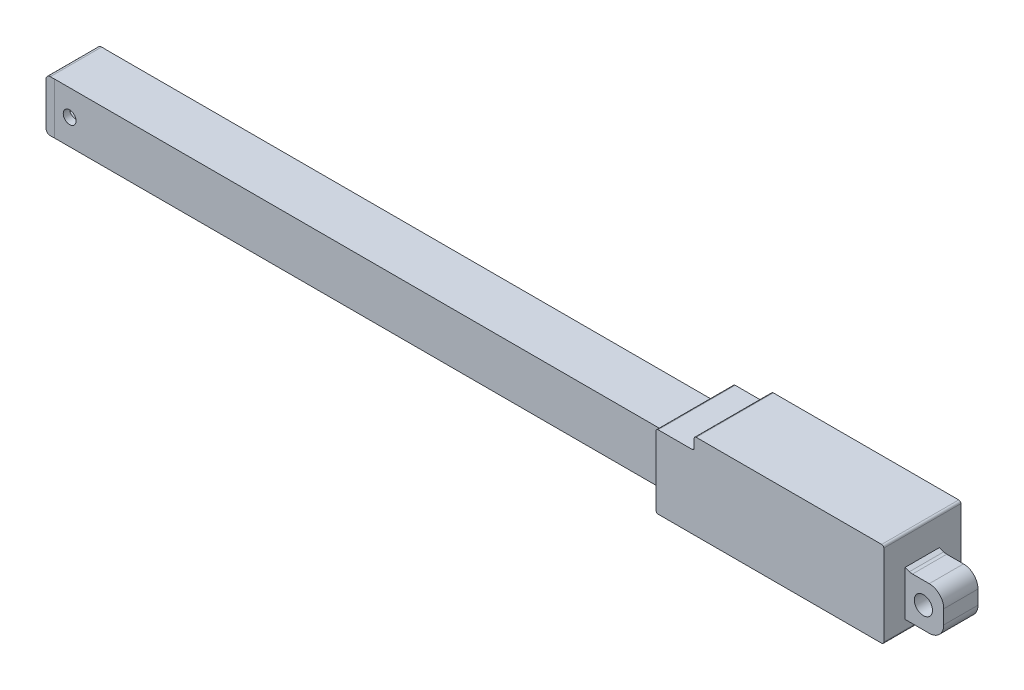
from build123d import *

# Parameters (mm, degrees)
SKETCH2_R           = 2.125
BOSS_EXTRUDE1_DEPTH = 9
SKETCH2_3_W         = 143.4775
SKETCH2_3_H         = 11.945
SKETCH2_3_R         = 1.5
BOSS_EXTRUDE2_DEPTH = 5.975
BOSS_EXTRUDE3_DEPTH = 6
SKETCH7_R           = 4.45
CUT_EXTRUDE4_DEPTH  = 138
CUT_EXTRUDE6_DEPTH  = 5
CUT_EXTRUDE7_DEPTH  = 5


with BuildPart() as part:
    # Sketch2 → Boss-Extrude1 (new, symmetric)
    with BuildSketch(Plane.XY):
        with BuildLine():
            Line((145.4775, 14.0125), (145.4775, 11.945))
            Line((145.4775, 11.945), (145.4775, 0))
            Line((145.4775, 0), (145.4775, -2.0675))
            ThreePointArc((145.4775, -2.0675), (145.623946609, -2.421053391), (145.9775, -2.5675))
            Line((145.9775, -2.5675), (198.1775, -2.5675))
            ThreePointArc((198.1775, -2.5675), (198.531053391, -2.421053391), (198.6775, -2.0675))
            Line((198.6775, -2.0675), (198.6775, 0))
            Line((198.6775, 0), (204.28834363, 0))
            ThreePointArc((204.28834363, 0), (206.684839082, 0.992660918), (207.6775, 3.38915637))
            Line((207.6775, 3.38915637), (207.6775, 6.65334363))
            ThreePointArc((207.6775, 6.65334363), (206.684839082, 9.049839082), (204.28834363, 10.0425))
            Line((204.28834363, 10.0425), (200.377364582, 10.0425))
            ThreePointArc((200.377364582, 10.0425), (200.021766481, 10.074366369), (199.6775, 10.168950009))
            Line((199.6775, 10.168950009), (198.6775, 10.5425))
            Line((198.6775, 10.5425), (198.6775, 16.9325))
            ThreePointArc((198.6775, 16.9325), (198.531053391, 17.286053391), (198.1775, 17.4325))
            Line((198.1775, 17.4325), (154.8775, 17.4325))
            ThreePointArc((154.8775, 17.4325), (154.523946609, 17.286053391), (154.3775, 16.9325))
            Line((154.3775, 16.9325), (154.3775, 15.0125))
            ThreePointArc((154.3775, 15.0125), (154.231053391, 14.658946609), (153.8775, 14.5125))
            Line((153.8775, 14.5125), (145.9775, 14.5125))
            ThreePointArc((145.9775, 14.5125), (145.623946609, 14.366053391), (145.4775, 14.0125))
        make_face()
        with Locations((202.9275, 5.02125)):
            Circle(SKETCH2_R, mode=Mode.SUBTRACT)
    extrude(amount=BOSS_EXTRUDE1_DEPTH, both=True)

    # Sketch2<3> → Boss-Extrude2 (add, symmetric)
    with BuildSketch(Plane.XY):
        with Locations((73.73875, 5.9725)):
            Rectangle(SKETCH2_3_W, SKETCH2_3_H)
        with Locations((5.5, 5.9725)):
            Circle(SKETCH2_3_R, mode=Mode.SUBTRACT)
    extrude(amount=BOSS_EXTRUDE2_DEPTH, both=True)

    # Sketch2<4> → Boss-Extrude3 (add, symmetric)
    with BuildSketch(Plane.XY):
        with BuildLine():
            Line((2, 0), (2, 11.945))
            Line((2, 11.945), (1, 11.945))
            ThreePointArc((1, 11.945), (0.292893219, 11.652106781), (0, 10.945))
            Line((0, 10.945), (0, 1))
            ThreePointArc((0, 1), (0.292893219, 0.292893219), (1, 0))
            Line((1, 0), (2, 0))
        make_face()
    extrude(amount=BOSS_EXTRUDE3_DEPTH, both=True)

    # Sketch7 → Cut-Extrude4 (cut)
    with BuildSketch(Plane.ZY):
        with Locations((0, 5.9725)):
            Circle(SKETCH7_R)
    extrude(amount=-CUT_EXTRUDE4_DEPTH, mode=Mode.SUBTRACT)

    # Sketch8 → Cut-Extrude6 (cut, symmetric)
    with BuildSketch(Plane.XY.offset(9)):
        Polygon((198.6775, 10.5425), (211.452070609, 15.905902501), (207.012502563, -2.059702975), (198.6775, 0), align=None)
    extrude(amount=CUT_EXTRUDE6_DEPTH, both=True, mode=Mode.SUBTRACT)

    # Sketch10 → Cut-Extrude7 (cut, symmetric)
    with BuildSketch(Plane(origin=(0, 0, -9), x_dir=(-1, 0, 0), z_dir=(0, 0, -1))):
        Polygon((-198.6775, 10.5425), (-218.686725566, 39.11278538), (-201.443333916, -35.592944689), (-198.6775, 0), align=None)
    extrude(amount=CUT_EXTRUDE7_DEPTH, both=True, mode=Mode.SUBTRACT)


solid = part.part
